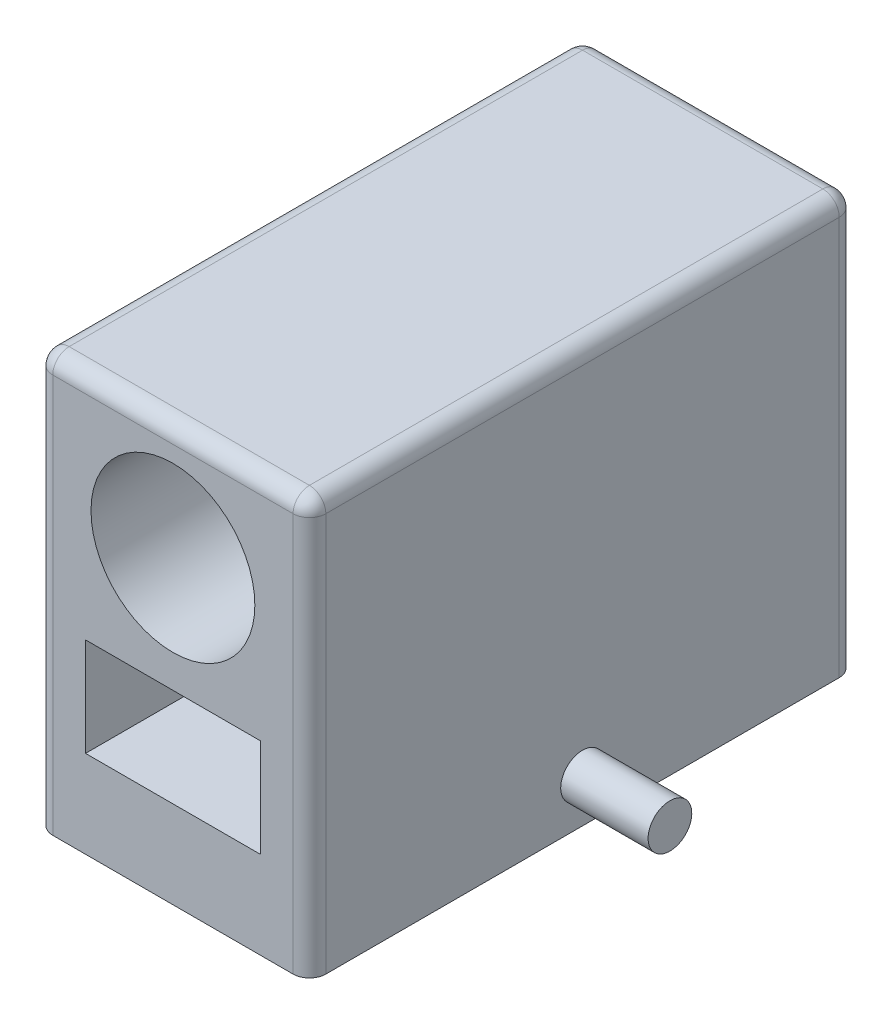
from build123d import *

# Parameters (mm, degrees)
SKETCH_1_W          = 25
SKETCH_1_H          = 38
EXTRUDE_1_DEPTH     = 50
SKETCH_2_R          = 7.5
CUT_EXTRUDE_1_DEPTH = 13
SKETCH_3_W          = 21
SKETCH_3_H          = 36
CUT_EXTRUDE_2_DEPTH = 35
SKETCH_4_W          = 16
SKETCH_4_H          = 9
CUT_EXTRUDE_3_DEPTH = 10
FILLET_1_R          = 1.5
FILLET_2_R          = 1.5
FILLET_3_R          = 1.5
SKETCH_5_R          = 2
EXTRUDE_2_DEPTH     = 8
CUT_EXTRUDE_4_REACH = 72.944
SKETCH_6_W          = 16
SKETCH_6_H          = 9


with BuildPart() as part:
    # 草图1 → 凸台-拉伸1 (new body)
    with BuildSketch(Plane.XY):
        with Locations((12.5, 19)):
            Rectangle(SKETCH_1_W, SKETCH_1_H)
    extrude(amount=-EXTRUDE_1_DEPTH)

    # 草图2 → 切除-拉伸1 (cut)
    with BuildSketch(Plane.XY):
        with Locations((12.5, 27.5)):
            Circle(SKETCH_2_R)
    extrude(amount=-CUT_EXTRUDE_1_DEPTH, mode=Mode.SUBTRACT)

    # 草图3 → 切除-拉伸2 (cut)
    with BuildSketch(Plane.XY.offset(-13)):
        with Locations((12.5, 18)):
            Rectangle(SKETCH_3_W, SKETCH_3_H)
    extrude(amount=-CUT_EXTRUDE_2_DEPTH, mode=Mode.SUBTRACT)

    # 草图4 → 切除-拉伸3 (cut)
    with BuildSketch(Plane(origin=(2, 0, 0), x_dir=(0, 0, -1), z_dir=(1, 0, 0))):
        with Locations((30, 4.5)):
            Rectangle(SKETCH_4_W, SKETCH_4_H)
    extrude(amount=-CUT_EXTRUDE_3_DEPTH, mode=Mode.SUBTRACT)

    # 圆角1
    fillet_1_edges = [part.edges().sort_by_distance(p)[0] for p in [
        (12.5, 38, -50),
        (12.5, 38, 0),
        (0, 38, -25),
        (25, 38, -25),
    ]]
    fillet(fillet_1_edges, radius=FILLET_1_R)

    # 圆角2
    # the kernel refuses this fillet: 1.5 mm, written as the material it takes off along each edge
    with BuildSketch(Plane(origin=(1.5, 36.5, -48.5), x_dir=(0, 0, -1), z_dir=(-1, 0, 0))) as fillet_2_piece_1_section:
        Polygon((0, 0), (FILLET_2_R, 0), (FILLET_2_R, -FILLET_2_R), (0, -FILLET_2_R), align=None)
    fillet_2_piece_1 = extrude(amount=FILLET_2_R, mode=Mode.PRIVATE)
    fillet_2_piece_1 = fillet_2_piece_1 - Plane(origin=(1.5, 36.5, -48.5), x_dir=(0, -0.7071067811865475, 0.7071067811865475), z_dir=(-1, 0, 0)) * Sphere(FILLET_2_R, mode=Mode.PRIVATE)
    add(fillet_2_piece_1, mode=Mode.SUBTRACT)
    with BuildSketch(Plane(origin=(1.5, 36.5, -1.5), x_dir=(0, 0, 1), z_dir=(-1, 0, 0))) as fillet_2_piece_2_section:
        Polygon((0, 0), (FILLET_2_R, 0), (FILLET_2_R, FILLET_2_R), (0, FILLET_2_R), align=None)
    fillet_2_piece_2 = extrude(amount=FILLET_2_R, mode=Mode.PRIVATE)
    fillet_2_piece_2 = fillet_2_piece_2 - Plane(origin=(1.5, 36.5, -1.5), x_dir=(0, -0.7071067811865475, -0.7071067811865475), z_dir=(-1, 0, 0)) * Sphere(FILLET_2_R, mode=Mode.PRIVATE)
    add(fillet_2_piece_2, mode=Mode.SUBTRACT)
    with BuildSketch(Plane(origin=(23.5, 36.5, -48.5), x_dir=(1, 0, 0), z_dir=(0, 0, -1))) as fillet_2_piece_3_section:
        Polygon((0, 0), (FILLET_2_R, 0), (FILLET_2_R, -FILLET_2_R), (0, -FILLET_2_R), align=None)
    fillet_2_piece_3 = extrude(amount=FILLET_2_R, mode=Mode.PRIVATE)
    fillet_2_piece_3 = fillet_2_piece_3 - Plane(origin=(23.5, 36.5, -48.5), x_dir=(-0.7071067811865476, -0.7071067811865476, 0), z_dir=(0, 0, -1)) * Sphere(FILLET_2_R, mode=Mode.PRIVATE)
    add(fillet_2_piece_3, mode=Mode.SUBTRACT)
    with BuildSketch(Plane(origin=(0, -3.75, -50), x_dir=(0, 0, 1), z_dir=(0, 1, 0))) as fillet_2_piece_4:
        with BuildLine():
            CenterArc((FILLET_2_R, FILLET_2_R), FILLET_2_R, 180, 90)
            Line((0, FILLET_2_R), (0, 0))
            Line((0, 0), (FILLET_2_R, 0))
        make_face()
    extrude(amount=40.25, mode=Mode.SUBTRACT)
    with BuildSketch(Plane(origin=(0, -3.75, 0), x_dir=(0, 0, -1), z_dir=(0, 1, 0)), Plane(origin=(25, 36.5, -50), x_dir=(-1, 0, 0), z_dir=(0, -1, 0))) as fillet_2_piece_5:
        with BuildLine():
            CenterArc((FILLET_2_R, -FILLET_2_R), FILLET_2_R, 90, 90)
            Line((0, -FILLET_2_R), (0, 0))
            Line((0, 0), (FILLET_2_R, 0))
        make_face()
    extrude(amount=40.25, mode=Mode.SUBTRACT)

    # 圆角3
    # the kernel refuses this fillet: 1.5 mm, written as the material it takes off along each edge
    with BuildSketch(Plane(origin=(23.5, 36.5, -1.5), x_dir=(1, 0, 0), z_dir=(0, 0, 1))) as fillet_3_piece_1_section:
        Polygon((0, 0), (FILLET_3_R, 0), (FILLET_3_R, FILLET_3_R), (0, FILLET_3_R), align=None)
    fillet_3_piece_1 = extrude(amount=FILLET_3_R, mode=Mode.PRIVATE)
    fillet_3_piece_1 = fillet_3_piece_1 - Plane(origin=(23.5, 36.5, -1.5), x_dir=(-0.7071067811865476, -0.7071067811865476, 0), z_dir=(0, 0, 1)) * Sphere(FILLET_3_R, mode=Mode.PRIVATE)
    add(fillet_3_piece_1, mode=Mode.SUBTRACT)
    with BuildSketch(Plane(origin=(25, 36.5, 0), x_dir=(-1, 0, 0), z_dir=(0, -1, 0))) as fillet_3_piece_2:
        with BuildLine():
            CenterArc((FILLET_3_R, FILLET_3_R), FILLET_3_R, 180, 90)
            Line((0, FILLET_3_R), (0, 0))
            Line((0, 0), (FILLET_3_R, 0))
        make_face()
    extrude(amount=40.25, mode=Mode.SUBTRACT)

    # 草图5 → 凸台-拉伸2 (add)
    with BuildSketch(Plane(origin=(25, 0, 0), x_dir=(0, 0, -1), z_dir=(1, 0, 0))):
        with Locations(Location((25, 4, 0), (0, 0, 90))):
            Circle(SKETCH_5_R)
    extrude(amount=EXTRUDE_2_DEPTH)

    # 草图6 → 切除-拉伸4 (cut, up to next)
    with BuildSketch(Plane.XY, mode=Mode.PRIVATE) as cut_extrude_4_sk1:
        with Locations((12.5, 12.5)):
            Rectangle(SKETCH_6_W, SKETCH_6_H)
    cut_extrude_4_tool1 = extrude(cut_extrude_4_sk1.sketch, amount=-CUT_EXTRUDE_4_REACH, mode=Mode.PRIVATE) & part.part
    add(cut_extrude_4_tool1.solids().sort_by_distance((12.5, 12.5, 0))[0], mode=Mode.SUBTRACT)


solid = part.part
